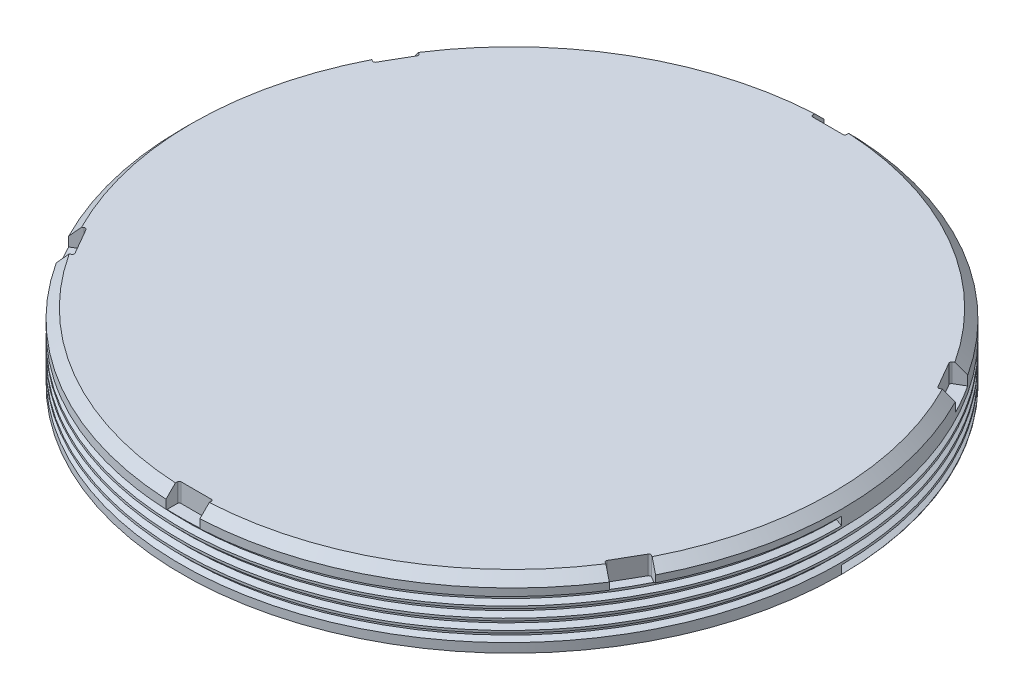
from build123d import *

# Parameters (mm, degrees)
SKETCH1_R           = 17.5
BOSS_EXTRUDE1_DEPTH = 3.5
CHAMFER1_SIZE       = 0.5
CUT_EXTRUDE1_DEPTH  = 1
SKETCH4_R           = 15.75
CUT_EXTRUDE2_DEPTH  = 1.5
FILLET1_R           = 1
THREAD1_PITCH       = 0.56


with BuildPart() as part:
    # Sketch1 → Boss-Extrude1 (new body)
    with BuildSketch(Plane(origin=(0, 0, 0), x_dir=(1, 0, 0), z_dir=(0, 1, 0))):
        with Locations(Location((0, 0, 0), (0, 0, 270))):
            Circle(SKETCH1_R)
    extrude(amount=BOSS_EXTRUDE1_DEPTH)

    # Chamfer1
    chamfer1_edges = [part.edges().sort_by_distance(p)[0] for p in [
        (0, 3.5, -17.5),
    ]]
    chamfer(chamfer1_edges, length=CHAMFER1_SIZE)

    # Sketch3 → Cut-Extrude1 (cut)
    with BuildSketch(Plane(origin=(0, 3.5, 0), x_dir=(1, 0, 0), z_dir=(0, 1, 0))):
        with BuildLine():
            Line((14.163644775, 9.216614608), (14.700580525, 9.526614608))
            ThreePointArc((14.700580525, 9.526614608), (15.170616014, 8.75875924), (15.600580525, 7.967768881))
            Line((15.600580525, 7.967768881), (15.063644775, 7.657768881))
            ThreePointArc((15.063644775, 7.657768881), (14.98776287, 7.647778839), (14.927042235, 7.694371422))
            Line((14.927042235, 7.694371422), (14.127042235, 9.080012068))
            ThreePointArc((14.127042235, 9.080012068), (14.117052192, 9.155893972), (14.163644775, 9.216614608))
        make_face()
        with BuildLine():
            Line((-0.8, 16.774383489), (0.8, 16.774383489))
            ThreePointArc((0.8, 16.774383489), (0.870710678, 16.803672811), (0.9, 16.874383489))
            Line((0.9, 16.874383489), (0.9, 17.494383489))
            ThreePointArc((0.9, 17.494383489), (0, 17.517518479), (-0.9, 17.494383489))
            Line((-0.9, 17.494383489), (-0.9, 16.874383489))
            ThreePointArc((-0.9, 16.874383489), (-0.870710678, 16.803672811), (-0.8, 16.774383489))
        make_face()
        with BuildLine():
            Line((15.063644775, -7.657768881), (15.600580525, -7.967768881))
            ThreePointArc((15.600580525, -7.967768881), (15.170616014, -8.75875924), (14.700580525, -9.526614608))
            Line((14.700580525, -9.526614608), (14.163644775, -9.216614608))
            ThreePointArc((14.163644775, -9.216614608), (14.117052192, -9.155893972), (14.127042235, -9.080012068))
            Line((14.127042235, -9.080012068), (14.927042235, -7.694371422))
            ThreePointArc((14.927042235, -7.694371422), (14.98776287, -7.647778839), (15.063644775, -7.657768881))
        make_face()
        with BuildLine():
            Line((0.9, -16.874383489), (0.9, -17.494383489))
            ThreePointArc((0.9, -17.494383489), (0, -17.517518479), (-0.9, -17.494383489))
            Line((-0.9, -17.494383489), (-0.9, -16.874383489))
            ThreePointArc((-0.9, -16.874383489), (-0.870710678, -16.803672811), (-0.8, -16.774383489))
            Line((-0.8, -16.774383489), (0.8, -16.774383489))
            ThreePointArc((0.8, -16.774383489), (0.870710678, -16.803672811), (0.9, -16.874383489))
        make_face()
        with BuildLine():
            Line((-14.163644775, -9.216614608), (-14.700580525, -9.526614608))
            ThreePointArc((-14.700580525, -9.526614608), (-15.170616014, -8.75875924), (-15.600580525, -7.967768881))
            Line((-15.600580525, -7.967768881), (-15.063644775, -7.657768881))
            ThreePointArc((-15.063644775, -7.657768881), (-14.98776287, -7.647778839), (-14.927042235, -7.694371422))
            Line((-14.927042235, -7.694371422), (-14.127042235, -9.080012068))
            ThreePointArc((-14.127042235, -9.080012068), (-14.117052192, -9.155893972), (-14.163644775, -9.216614608))
        make_face()
        with BuildLine():
            Line((-15.063644775, 7.657768881), (-15.600580525, 7.967768881))
            ThreePointArc((-15.600580525, 7.967768881), (-15.170616014, 8.75875924), (-14.700580525, 9.526614608))
            Line((-14.700580525, 9.526614608), (-14.163644775, 9.216614608))
            ThreePointArc((-14.163644775, 9.216614608), (-14.117052192, 9.155893972), (-14.127042235, 9.080012068))
            Line((-14.127042235, 9.080012068), (-14.927042235, 7.694371422))
            ThreePointArc((-14.927042235, 7.694371422), (-14.98776287, 7.647778839), (-15.063644775, 7.657768881))
        make_face()
    extrude(amount=-CUT_EXTRUDE1_DEPTH, mode=Mode.SUBTRACT)

    # Sketch4 → Cut-Extrude2 (cut)
    with BuildSketch(Plane(origin=(0, 0, 0), x_dir=(-1, 0, 0), z_dir=(0, -1, 0))):
        with Locations(Location((0, 0, 0), (0, 0, 90))):
            Circle(SKETCH4_R)
    extrude(amount=-CUT_EXTRUDE2_DEPTH, mode=Mode.SUBTRACT)

    # Fillet1
    fillet1_edges = [part.edges().sort_by_distance(p)[0] for p in [
        (0, 1.5, 15.75),
    ]]
    fillet(fillet1_edges, radius=FILLET1_R)

    # Thread1: the profile of Thread Profile2 profile screwed along a right-hand helix of 4 turns, 6 arcs to a turn; built about Z, then put on its axis
    thread1_z = Axis((0, 0, 0), (0, 0, 1))
    thread1_corners = [(17.5003, 0, -0.000173205), (17.5003, 0, 0.437673204), (17.229367062, 0, 0.281249999), (17.229367062, 0, 0.156249999)]
    with BuildLine(mode=Mode.PRIVATE) as thread1_profile:
        Line(thread1_corners[0], thread1_corners[1])
        Line(thread1_corners[1], thread1_corners[2])
        Line(thread1_corners[2], thread1_corners[3])
        Line(thread1_corners[3], thread1_corners[0])
    thread1_cap = Face(thread1_profile.wire())
    thread1_turn_angles = [0, 30, 60, 90, 120, 150, 180, 210, 240, 270, 300, 330, 360]
    thread1_turn_weights = [1, 0.8660254037844387, 1, 0.8660254037844387, 1, 0.8660254037844387, 1, 0.8660254037844387, 1, 0.8660254037844387, 1, 0.8660254037844387, 1]
    thread1_turn_rails = [Edge.make_bspline([Vector(p[0], p[1], 0).rotate(thread1_z, thread1_turn_angles[k]) / thread1_turn_weights[k] + Vector(0, 0, p[2] + THREAD1_PITCH * thread1_turn_angles[k] / 360) for k in range(13)], [0, 0, 0, 1, 1, 2, 2, 3, 3, 4, 4, 5, 5, 6, 6, 6], 2, thread1_turn_weights) for p in thread1_corners]
    thread1_turn_sides = [Face.make_surface_from_curves(thread1_turn_rails[p[0]], thread1_turn_rails[p[1]]) for p in [(0, 1), (1, 2), (2, 3), (3, 0)]]
    thread1 = Plane(origin=(0, 0, 0), x_dir=(1, 0, 0), z_dir=(0, 1, 0)) * Solid(Shell([*[p.moved(Location((0, 0, THREAD1_PITCH * i))) for i in range(4) for p in thread1_turn_sides], thread1_cap, thread1_cap.rotate(thread1_z, 1440).moved(Location((0, 0, THREAD1_PITCH * 1440 / 360)))]))
    add(thread1, mode=Mode.SUBTRACT)


solid = part.part
